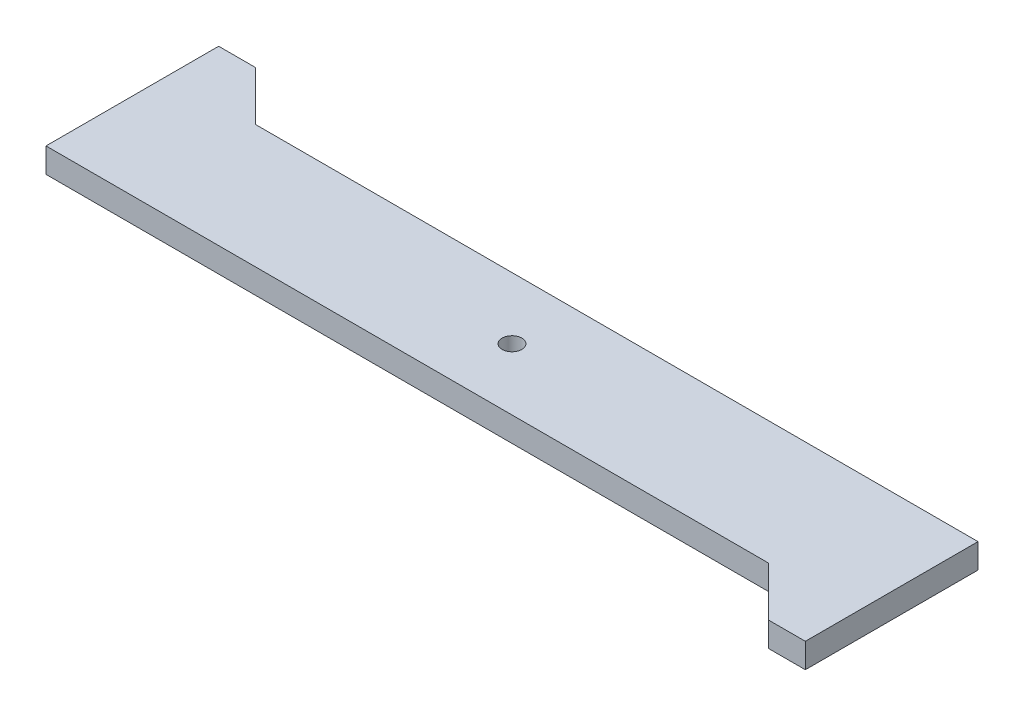
from build123d import *

# Parameters (mm, degrees)
SKETCH1_R           = 4
BOSS_EXTRUDE1_DEPTH = 10


with BuildPart() as part:
    # Sketch1 → Boss-Extrude1 (new body)
    with BuildSketch(Plane(origin=(0, 0, 0), x_dir=(1, 0, 0), z_dir=(0, 1, 0))):
        Polygon((-163.935963108, 45), (-163.935963108, -25), (128.935963108, -25), (148.935963108, -45), (163.935963108, -45), (163.935963108, 25), (-128.935963108, 25), (-148.935963108, 45), align=None)
        Circle(SKETCH1_R, mode=Mode.SUBTRACT)
    extrude(amount=BOSS_EXTRUDE1_DEPTH)


solid = part.part
